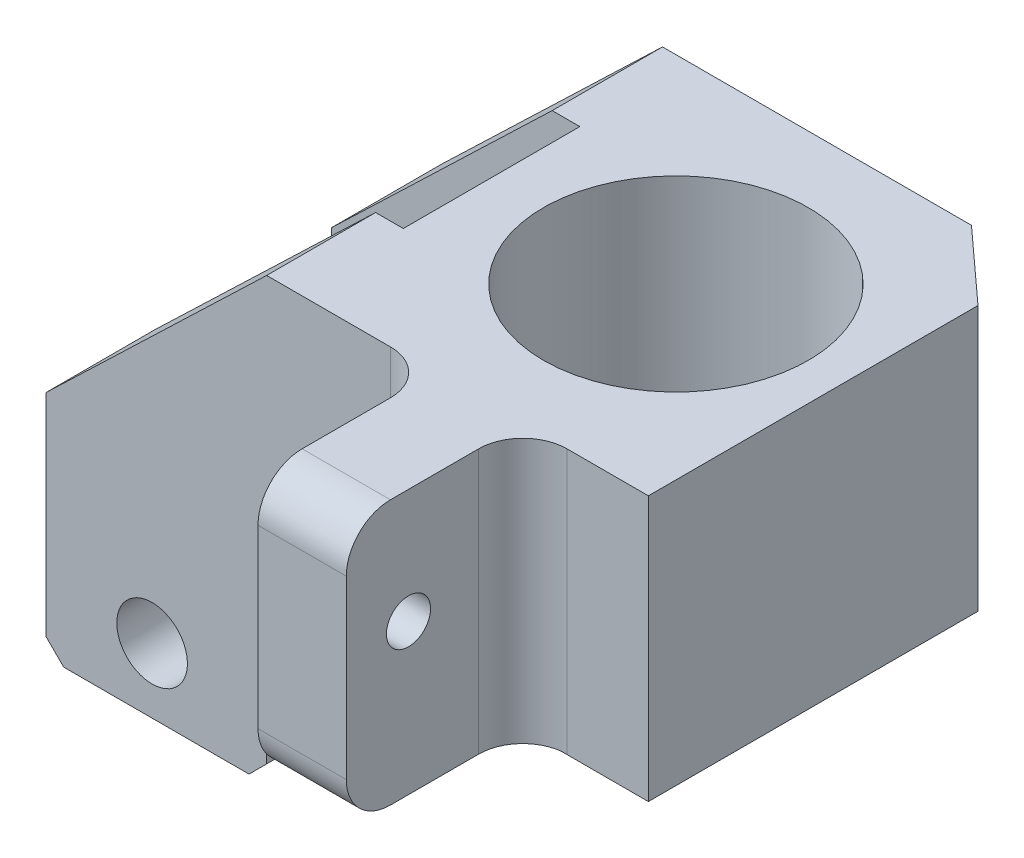
from build123d import *

# Parameters (mm, degrees)
EXTRUDE_1_DEPTH       = 30
SKETCH_2_R            = 15
CUT_EXTRUDE_2_DEPTH   = 45.532745299
EXTRUDE_3_DEPTH       = 44.84276
CUT_EXTRUDE_START     = 70
SKETCH_3_W            = 44.656689001
SKETCH_3_H            = 20
CUT_EXTRUDE_1_DEPTH   = 130
SKETCH_7_R            = 3.999999997
CUT_EXTRUDE_2_2_DEPTH = 73.895417278
FILLET_1_R            = 5
CHAMFER_5_SIZE        = 2
SKETCH_8_W            = 10
SKETCH_8_H            = 29.95730412
EXTRUDE_4_DEPTH       = 20
FILLET_2_R            = 5
SKETCH_10_R           = 2.5
CUT_EXTRUDE_3_DEPTH   = 75.906399488


with BuildPart() as part:
    # Эскиз1 → Вытянуть1 (new body)
    with BuildSketch(Plane(origin=(0, 0, 0), x_dir=(1, 0, 0), z_dir=(0, 1, 0))):
        Polygon((-24.019063342, 22.5), (10.980936658, 22.5), (19.22346273, 15), (19.22346273, -22.342761837), (-24.019063342, -22.342761837), align=None)
    extrude(amount=EXTRUDE_1_DEPTH)

    # Эскиз2 → Cut-Extrude 2 (cut, through all)
    with BuildSketch(Plane(origin=(0, 30, 0), x_dir=(1, 0, 0), z_dir=(0, 1, 0))):
        with Locations(Location((0, 0, 0), (0, 0, 270))):
            Circle(SKETCH_2_R)
    extrude(amount=-CUT_EXTRUDE_2_DEPTH, mode=Mode.SUBTRACT)

    # Эскиз6 → Вытянуть3 (add)
    with BuildSketch(Plane(origin=(0, 0, -22.5), x_dir=(-1, 0, 0), z_dir=(0, 0, -1))):
        Polygon((24.019063342, -19.927530698), (24.019063342, 30), (49.019063342, 6.012561534), (49.019063342, -19.927530698), align=None)
    extrude(amount=-EXTRUDE_3_DEPTH)

    # Эскиз3 → Вырез-Вытянуть1 (cut)
    with BuildSketch(Plane(origin=(0, 30, 0), x_dir=(1, 0, 0), z_dir=(0, 1, 0)).offset(CUT_EXTRUDE_START)):
        with Locations((-43.210774099, 0)):
            Rectangle(SKETCH_3_W, SKETCH_3_H)
    extrude(amount=-CUT_EXTRUDE_1_DEPTH, mode=Mode.SUBTRACT)

    # Эскиз7 → Cut-Extrude 2 2 (cut, through all)
    with BuildSketch(Plane(origin=(0, 0, -22.5), x_dir=(-1, 0, 0), z_dir=(0, 0, -1))):
        with Locations((37.000000002, -12.578306382)):
            Circle(SKETCH_7_R)
    extrude(amount=-CUT_EXTRUDE_2_2_DEPTH, mode=Mode.SUBTRACT)

    # Скругление1
    # the kernel refuses this fillet: 5 mm, written as the material it adds along each edge
    with BuildSketch(Plane(origin=(-24.019063342, 0, 34.84276), x_dir=(1, 0, 0), z_dir=(0, 0, -1))) as fillet_1_piece_1_section:
        with BuildLine():
            CenterArc((FILLET_1_R, FILLET_1_R), FILLET_1_R, 180, 90)
            Line((0, FILLET_1_R), (0, 0))
            Line((0, 0), (FILLET_1_R, 0))
        make_face()
    fillet_1_piece_1 = extrude(amount=24.84276, mode=Mode.PRIVATE)
    fillet_1_piece_1 = split(fillet_1_piece_1, bisect_by=Plane(origin=(-20.42000997, -0.107354451, 22.342761837), z_dir=(0, 0, -1)), keep=Keep.TOP, mode=Mode.PRIVATE)
    add(fillet_1_piece_1)
    with BuildSketch(Plane(origin=(-24.019063342, 0, 22.34276), x_dir=(1, 0, 0), z_dir=(0, 0, -1))) as fillet_1_piece_2_section:
        with BuildLine():
            CenterArc((FILLET_1_R, FILLET_1_R), FILLET_1_R, 180, 90)
            Line((0, FILLET_1_R), (0, 0))
            Line((0, 0), (FILLET_1_R, 0))
        make_face()
    fillet_1_piece_2 = extrude(amount=24.84276, mode=Mode.PRIVATE)
    fillet_1_piece_2 = split(fillet_1_piece_2, bisect_by=Plane(origin=(-20.882429598, -0.107354451, 3.75), z_dir=(1, 0, 0)), keep=Keep.TOP, mode=Mode.PRIVATE)
    add(fillet_1_piece_2)
    with BuildSketch(Plane(origin=(-24.019063342, 0, 2.5), x_dir=(1, 0, 0), z_dir=(0, 0, -1))) as fillet_1_piece_3_section:
        with BuildLine():
            CenterArc((FILLET_1_R, FILLET_1_R), FILLET_1_R, 180, 90)
            Line((0, FILLET_1_R), (0, 0))
            Line((0, 0), (FILLET_1_R, 0))
        make_face()
    fillet_1_piece_3 = extrude(amount=25, mode=Mode.PRIVATE)
    fillet_1_piece_3 = split(fillet_1_piece_3, bisect_by=Plane(origin=(-20.882429598, -0.107354451, -3.75), z_dir=(1, 0, 0)), keep=Keep.TOP, mode=Mode.PRIVATE)
    add(fillet_1_piece_3)
    with BuildSketch(Plane(origin=(-24.019063342, 0, -10), x_dir=(1, 0, 0), z_dir=(0, 0, -1))) as fillet_1_piece_4:
        with BuildLine():
            CenterArc((FILLET_1_R, FILLET_1_R), FILLET_1_R, 180, 90)
            Line((0, FILLET_1_R), (0, 0))
            Line((0, 0), (FILLET_1_R, 0))
        make_face()
    extrude(amount=12.5)
    # the kernel refuses this fillet: 5 mm, written as the material it takes off along each edge

    # Фаска5
    chamfer_5_edges = [part.edges().sort_by_distance(p)[0] for p in [
        (-49.019063342, -19.927530698, 16.17138),
        (-24.019063342, -19.927530698, 16.17138),
        (-24.019063342, -19.927530698, -16.25),
        (-49.019063342, -19.927530698, -16.25),
    ]]
    chamfer(chamfer_5_edges, length=CHAMFER_5_SIZE)

    # Эскиз8 → Вытянуть4 (add)
    with BuildSketch(Plane.XY.offset(22.342761837)):
        with Locations((0, 15.02134794)):
            Rectangle(SKETCH_8_W, SKETCH_8_H)
    extrude(amount=EXTRUDE_4_DEPTH)

    # Скругление2
    fillet_2_edges = [part.edges().sort_by_distance(p)[0] for p in [
        (0, 30, 42.342761837),
        (0, 0.04269588, 42.342761837),
        (-5, 15.02134794, 22.342761837),
        (5, 15.02134794, 22.342761837),
    ]]
    fillet(fillet_2_edges, radius=FILLET_2_R)

    # Эскиз10 → Вырез-Вытянуть3 (cut, through all)
    with BuildSketch(Plane(origin=(5, 0, 0), x_dir=(0, 0, -1), z_dir=(1, 0, 0))):
        with Locations(Location((-35.296798075, 17.052712081, 0), (0, 0, 90))):
            Circle(SKETCH_10_R)
    extrude(amount=-CUT_EXTRUDE_3_DEPTH, mode=Mode.SUBTRACT)


solid = part.part
